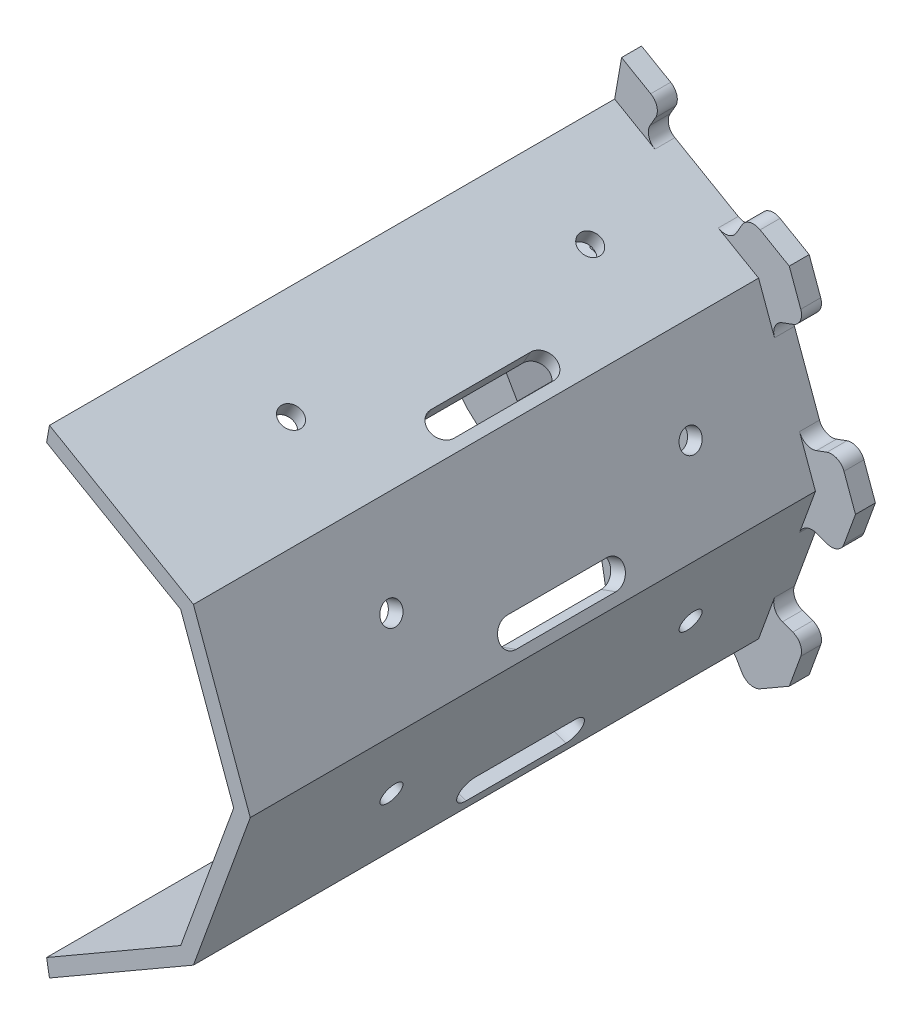
from build123d import *

# Parameters (mm, degrees)
BOSS_EXTRUDE1_DEPTH = 85
CUT_EXTRUDE1_DEPTH  = 100.2782481367037
CUT_EXTRUDE2_REACH  = 121.163
SKETCH3_R           = 1.6500000000000004
SKETCH3_R_2         = 1.65
CUT_EXTRUDE6_REACH  = 120.075
SKETCH4_R           = 1.6500000000000006
SKETCH4_R_2         = 1.6500000000000021
CUT_EXTRUDE7_REACH  = 120.075
SKETCH5_R           = 1.6499999999999986
SKETCH5_R_2         = 1.6499999999999955
CUT_EXTRUDE8_REACH  = 121.163
SKETCH6_R           = 1.65
SKETCH6_R_2         = 1.6499999999999995
BOSS_EXTRUDE2_DEPTH = 3
SKETCH8_R           = 15
BOSS_EXTRUDE3_DEPTH = 5
CUT_EXTRUDE9_DEPTH  = 6
CUT_EXTRUDE10_REACH = 106.715
SKETCH10_R          = 3.5
CUT_EXTRUDE12_REACH = 105.896
FILLET1_R           = 2
CUT_EXTRUDE13_REACH = 105.896
CUT_EXTRUDE14_REACH = 105.896
CUT_EXTRUDE15_REACH = 105.896
FILLET2_R           = 2
CUT_EXTRUDE16_REACH = 127.017
CUT_EXTRUDE17_REACH = 125.808
CUT_EXTRUDE18_REACH = 125.808
CUT_EXTRUDE19_REACH = 127.017
CUT_EXTRUDE20_DEPTH = 1
SPLIT3_START        = -3
SPLIT3_DEPTH        = 88


# Read off the part's stored shape, not the designer's step: Split3
with BuildPart() as part:
    # Sketch1 → Boss-Extrude1 (new body)
    with BuildSketch(Plane.XY):
        Polygon((36.54755500203861, 0), (27.99705141889689, 23.49231551964772), (6.346416324285921, 35.992315519647725), (-18.2737775010193, 31.651111077974463), (-34.34346774318279, 12.499999999999993), (-34.34346774318279, -12.5), (-18.2737775010193, -31.651111077974456), (6.346416324285918, -35.99231551964772), (27.997051418896884, -23.492315519647722), align=None)
    extrude(amount=BOSS_EXTRUDE1_DEPTH)

    # Sketch2 → Cut-Extrude1 (cut, through all)
    with BuildSketch(Plane.XY.offset(85)):
        Polygon((34.053688719229186, -1.736e-14), (26.08663901106896, 21.88928917284279), (5.913360988931043, 33.53633666936129), (-17.0268443596146, 29.49135952342006), (-32.000000000000014, 11.647047496518487), (-32.00000000000002, -11.647047496518473), (-17.02684435961461, -29.491359523420048), (5.913360988931034, -33.53633666936129), (26.08663901106894, -21.889289172842815), align=None)
    extrude(amount=-CUT_EXTRUDE1_DEPTH, mode=Mode.SUBTRACT)

    # Sketch3 → Cut-Extrude2 (cut, up to next)
    with BuildSketch(Plane(origin=(17.1717338715914, 29.742315519647722, 0), x_dir=(0.8660254037844386, -0.5000000000000001, 0), z_dir=(0.5000000000000001, 0.8660254037844386, 0)), mode=Mode.PRIVATE) as cut_extrude2_sk1:
        with Locations(Location((0, -14.5, 0), (0, 0, 180))):
            Circle(SKETCH3_R)
    cut_extrude2_tool1 = extrude(cut_extrude2_sk1.sketch, amount=-CUT_EXTRUDE2_REACH, mode=Mode.PRIVATE) & part.part
    # Sketch3 → Cut-Extrude2 (cut, up to next)
    with BuildSketch(Plane(origin=(17.1717338715914, 29.742315519647722, 0), x_dir=(0.8660254037844386, -0.5000000000000001, 0), z_dir=(0.5000000000000001, 0.8660254037844386, 0)), mode=Mode.PRIVATE) as cut_extrude2_sk2:
        with Locations(Location((0, -59.5, 0), (0, 0, 180))):
            Circle(SKETCH3_R_2)
    cut_extrude2_tool2 = extrude(cut_extrude2_sk2.sketch, amount=-CUT_EXTRUDE2_REACH, mode=Mode.PRIVATE) & part.part
    add(cut_extrude2_tool1.solids().sort_by_distance((17.171734, 29.742316, 14.5))[0], mode=Mode.SUBTRACT)
    add(cut_extrude2_tool2.solids().sort_by_distance((17.171734, 29.742316, 59.5))[0], mode=Mode.SUBTRACT)

    # Sketch4 → Cut-Extrude6 (cut, up to next)
    with BuildSketch(Plane(origin=(32.27230321046776, 11.746157759823863, 0), x_dir=(0, 0, -1), z_dir=(0.9396926207859085, 0.34202014332566866, 0)), mode=Mode.PRIVATE) as cut_extrude6_sk1:
        with Locations(Location((-14.5, 0, 0), (0, 0, 90))):
            Circle(SKETCH4_R)
    cut_extrude6_tool1 = extrude(cut_extrude6_sk1.sketch, amount=-CUT_EXTRUDE6_REACH, mode=Mode.PRIVATE) & part.part
    # Sketch4 → Cut-Extrude6 (cut, up to next)
    with BuildSketch(Plane(origin=(32.27230321046776, 11.746157759823863, 0), x_dir=(0, 0, -1), z_dir=(0.9396926207859085, 0.34202014332566866, 0)), mode=Mode.PRIVATE) as cut_extrude6_sk2:
        with Locations(Location((-59.5, 0, 0), (0, 0, 90))):
            Circle(SKETCH4_R_2)
    cut_extrude6_tool2 = extrude(cut_extrude6_sk2.sketch, amount=-CUT_EXTRUDE6_REACH, mode=Mode.PRIVATE) & part.part
    add(cut_extrude6_tool1.solids().sort_by_distance((32.272303, 11.746158, 14.5))[0], mode=Mode.SUBTRACT)
    add(cut_extrude6_tool2.solids().sort_by_distance((32.272303, 11.746158, 59.5))[0], mode=Mode.SUBTRACT)

    # Sketch5 → Cut-Extrude7 (cut, up to next)
    with BuildSketch(Plane(origin=(32.27230321046775, -11.746157759823864, 0), x_dir=(0, 0, -1), z_dir=(0.9396926207859084, -0.34202014332566877, 0)), mode=Mode.PRIVATE) as cut_extrude7_sk1:
        with Locations(Location((-14.5, 1.73e-15, 0), (0, 0, 90))):
            Circle(SKETCH5_R)
    cut_extrude7_tool1 = extrude(cut_extrude7_sk1.sketch, amount=-CUT_EXTRUDE7_REACH, mode=Mode.PRIVATE) & part.part
    # Sketch5 → Cut-Extrude7 (cut, up to next)
    with BuildSketch(Plane(origin=(32.27230321046775, -11.746157759823864, 0), x_dir=(0, 0, -1), z_dir=(0.9396926207859084, -0.34202014332566877, 0)), mode=Mode.PRIVATE) as cut_extrude7_sk2:
        with Locations(Location((-59.5, 1.73e-15, 0), (0, 0, 90))):
            Circle(SKETCH5_R_2)
    cut_extrude7_tool2 = extrude(cut_extrude7_sk2.sketch, amount=-CUT_EXTRUDE7_REACH, mode=Mode.PRIVATE) & part.part
    add(cut_extrude7_tool1.solids().sort_by_distance((32.272303, -11.746158, 14.5))[0], mode=Mode.SUBTRACT)
    add(cut_extrude7_tool2.solids().sort_by_distance((32.272303, -11.746158, 59.5))[0], mode=Mode.SUBTRACT)

    # Sketch6 → Cut-Extrude8 (cut, up to next)
    with BuildSketch(Plane(origin=(17.171733871591393, -29.74231551964772, 0), x_dir=(0.8660254037844387, 0.4999999999999999, 0), z_dir=(0.4999999999999999, -0.8660254037844387, 0)), mode=Mode.PRIVATE) as cut_extrude8_sk1:
        with Locations((-1.73e-15, 14.5)):
            Circle(SKETCH6_R)
    cut_extrude8_tool1 = extrude(cut_extrude8_sk1.sketch, amount=-CUT_EXTRUDE8_REACH, mode=Mode.PRIVATE) & part.part
    # Sketch6 → Cut-Extrude8 (cut, up to next)
    with BuildSketch(Plane(origin=(17.171733871591393, -29.74231551964772, 0), x_dir=(0.8660254037844387, 0.4999999999999999, 0), z_dir=(0.4999999999999999, -0.8660254037844387, 0)), mode=Mode.PRIVATE) as cut_extrude8_sk2:
        with Locations((-1.73e-15, 59.5)):
            Circle(SKETCH6_R_2)
    cut_extrude8_tool2 = extrude(cut_extrude8_sk2.sketch, amount=-CUT_EXTRUDE8_REACH, mode=Mode.PRIVATE) & part.part
    add(cut_extrude8_tool1.solids().sort_by_distance((17.171734, -29.742316, 14.5))[0], mode=Mode.SUBTRACT)
    add(cut_extrude8_tool2.solids().sort_by_distance((17.171734, -29.742316, 59.5))[0], mode=Mode.SUBTRACT)

    # Sketch7 → Boss-Extrude2 (add)
    with BuildSketch(Plane(origin=(0, 0, 0), x_dir=(-1, 0, 0), z_dir=(0, 0, -1))):
        Polygon((39.999999999999886, 14.558809370648529), (21.28355544951785, 36.86419940427531), (-7.391701236164245, 41.92042083670155), (-32.60829876383648, 27.36161146605319), (-42.567110899036514, -4.2288e-13), (-32.60829876383592, -27.36161146605385), (-7.391701236163371, -41.920420836701695), (21.283555449518634, -36.86419940427485), (40.000000000000185, -14.558809370647692), align=None)
    extrude(amount=BOSS_EXTRUDE2_DEPTH)

    # Sketch8 → Boss-Extrude3 (add)
    with BuildSketch(Plane.XY):
        with Locations(Location((0, 0, 0), (0, 0, 180))):
            Circle(SKETCH8_R)
    extrude(amount=BOSS_EXTRUDE3_DEPTH)

    # Sketch9 → Cut-Extrude9 (cut)
    with BuildSketch(Plane.XY.offset(5)):
        Polygon((6.579999999999997, 1.3e-15), (3.2899999999999987, 5.698447156901607), (-3.2899999999999987, 5.698447156901609), (-6.58, 8.7e-16), (-3.2900000000000005, -5.698447156901607), (3.289999999999996, -5.69844715690161), align=None)
    extrude(amount=-CUT_EXTRUDE9_DEPTH, mode=Mode.SUBTRACT)

    # Sketch10 → Cut-Extrude10 (cut, up to next)
    with BuildSketch(Plane.XY.offset(-1), mode=Mode.PRIVATE) as cut_extrude10_sk1:
        Circle(SKETCH10_R)
    cut_extrude10_tool1 = extrude(cut_extrude10_sk1.sketch, amount=-CUT_EXTRUDE10_REACH, mode=Mode.PRIVATE) & part.part
    add(cut_extrude10_tool1.solids().sort_by_distance((0, 0, -1))[0], mode=Mode.SUBTRACT)

    # Sketch12 → Cut-Extrude12 (cut, up to next)
    with BuildSketch(Plane.XY, mode=Mode.PRIVATE) as cut_extrude12_sk1:
        Polygon((26.495190528383667, 30.891016151377276), (23.666924399975038, 25.992315519647523), (10.676543343208465, 33.49231551964752), (13.50480947161717, 38.39101615137741), align=None)
    cut_extrude12_tool1 = extrude(cut_extrude12_sk1.sketch, amount=-CUT_EXTRUDE12_REACH, mode=Mode.PRIVATE) & part.part
    add(cut_extrude12_tool1.solids().sort_by_distance((18.585867, 32.191666, 0))[0], mode=Mode.SUBTRACT)

    # Fillet1
    fillet1_edges = [part.edges().sort_by_distance(p)[0] for p in [
        (13.50480947161717, 38.39101615137741, -1.5),
        (26.495190528383667, 30.891016151377276, -1.5),
        (23.666924399975038, 25.992315519647523, -1.5),
        (10.676543343208465, 33.49231551964752, -1.5),
    ]]
    fillet(fillet1_edges, radius=FILLET1_R)

    # Sketch13 → Cut-Extrude13 (cut, up to next)
    with BuildSketch(Plane.XY, mode=Mode.PRIVATE) as cut_extrude13_sk1:
        Polygon((40.15285590637897, 6.633111077131995), (34.8374542854104, 4.698463103929174), (29.707152135525373, 18.793852415717794), (35.02255375649406, 20.728500388920715), align=None)
    cut_extrude13_tool1 = extrude(cut_extrude13_sk1.sketch, amount=-CUT_EXTRUDE13_REACH, mode=Mode.PRIVATE) & part.part
    add(cut_extrude13_tool1.solids().sort_by_distance((34.930004, 12.713482, 0))[0], mode=Mode.SUBTRACT)

    # Sketch14 → Cut-Extrude14 (cut, up to next)
    with BuildSketch(Plane.XY, mode=Mode.PRIVATE) as cut_extrude14_sk1:
        Polygon((37.58770483143622, -13.680805733027139), (35.02255375649384, -20.728500388921514), (29.70715213552509, -18.79385241571856), (34.83745428541012, -4.698463103929938), (40.152855906378804, -6.633111077132863), align=None)
    cut_extrude14_tool1 = extrude(cut_extrude14_sk1.sketch, amount=-CUT_EXTRUDE14_REACH, mode=Mode.PRIVATE) & part.part
    add(cut_extrude14_tool1.solids().sort_by_distance((34.930004, -12.713482, 0))[0], mode=Mode.SUBTRACT)

    # Sketch15 → Cut-Extrude15 (cut, up to next)
    with BuildSketch(Plane.XY, mode=Mode.PRIVATE) as cut_extrude15_sk1:
        Polygon((19.99999999999965, -34.64101615137777), (13.504809471616262, -38.391016151377734), (10.67654334320774, -33.49231551964793), (23.666924399974317, -25.992315519647935), (26.49519052838297, -30.891016151377844), align=None)
    cut_extrude15_tool1 = extrude(cut_extrude15_sk1.sketch, amount=-CUT_EXTRUDE15_REACH, mode=Mode.PRIVATE) & part.part
    add(cut_extrude15_tool1.solids().sort_by_distance((18.585867, -32.191666, 0))[0], mode=Mode.SUBTRACT)

    # Fillet2
    fillet2_edges = [part.edges().sort_by_distance(p)[0] for p in [
        (35.02255375649406, 20.728500388920715, -1.5),
        (40.15285590637897, 6.633111077131995, -1.5),
        (34.8374542854104, 4.698463103929174, -1.5),
        (29.707152135525373, 18.793852415717794, -1.5),
        (40.152855906378804, -6.633111077132863, -1.5),
        (35.02255375649384, -20.728500388921514, -1.5),
        (29.70715213552509, -18.79385241571856, -1.5),
        (34.83745428541012, -4.698463103929938, -1.5),
        (26.49519052838297, -30.891016151377844, -1.5),
        (13.504809471616262, -38.391016151377734, -1.5),
        (10.67654334320774, -33.49231551964793, -1.5),
        (23.666924399974317, -25.992315519647935, -1.5),
    ]]
    fillet(fillet2_edges, radius=FILLET2_R)

    # Sketch16 → Cut-Extrude16 (cut, up to next)
    with BuildSketch(Plane(origin=(17.1717338715914, 29.742315519647722, 0), x_dir=(0.8660254037844386, -0.5000000000000001, 0), z_dir=(0.5000000000000001, 0.8660254037844386, 0)), mode=Mode.PRIVATE) as cut_extrude16_sk1:
        with BuildLine():
            Line((6.999999999999999, -44.5), (6.9999999999999964, -29.5))
            ThreePointArc((6.9999999999999964, -29.5), (8.999999999999996, -27.5), (10.999999999999996, -29.5))
            Line((10.999999999999996, -29.5), (11, -44.5))
            ThreePointArc((11, -44.5), (9, -46.5), (6.999999999999999, -44.5))
        make_face()
    cut_extrude16_tool1 = extrude(cut_extrude16_sk1.sketch, amount=-CUT_EXTRUDE16_REACH, mode=Mode.PRIVATE) & part.part
    add(cut_extrude16_tool1.solids().sort_by_distance((24.965963, 25.242316, 37))[0], mode=Mode.SUBTRACT)

    # Sketch17 → Cut-Extrude17 (cut, up to next)
    with BuildSketch(Plane(origin=(32.27230321046776, 11.746157759823863, 0), x_dir=(0, 0, -1), z_dir=(0.9396926207859085, 0.34202014332566866, 0)), mode=Mode.PRIVATE) as cut_extrude17_sk1:
        with BuildLine():
            Line((-44.5, -6.999999999999997), (-29.5, -6.999999999999995))
            ThreePointArc((-29.5, -6.999999999999995), (-27.5, -8.999999999999995), (-29.5, -10.999999999999995))
            Line((-29.5, -10.999999999999995), (-44.5, -10.999999999999998))
            ThreePointArc((-44.5, -10.999999999999998), (-46.5, -8.999999999999998), (-44.5, -6.999999999999997))
        make_face()
    cut_extrude17_tool1 = extrude(cut_extrude17_sk1.sketch, amount=-CUT_EXTRUDE17_REACH, mode=Mode.PRIVATE) & part.part
    add(cut_extrude17_tool1.solids().sort_by_distance((35.350485, 3.288924, 37))[0], mode=Mode.SUBTRACT)

    # Sketch18 → Cut-Extrude18 (cut, up to next)
    with BuildSketch(Plane(origin=(32.27230321046775, -11.746157759823864, 0), x_dir=(0, 0, -1), z_dir=(0.9396926207859084, -0.34202014332566877, 0)), mode=Mode.PRIVATE) as cut_extrude18_sk1:
        with BuildLine():
            Line((-44.5, -6.999999999999999), (-29.5, -6.9999999999999964))
            ThreePointArc((-29.5, -6.9999999999999964), (-27.5, -8.999999999999996), (-29.5, -10.999999999999996))
            Line((-29.5, -10.999999999999996), (-44.5, -11))
            ThreePointArc((-44.5, -11), (-46.5, -9), (-44.5, -6.999999999999999))
        make_face()
    cut_extrude18_tool1 = extrude(cut_extrude18_sk1.sketch, amount=-CUT_EXTRUDE18_REACH, mode=Mode.PRIVATE) & part.part
    add(cut_extrude18_tool1.solids().sort_by_distance((29.194122, -20.203391, 37))[0], mode=Mode.SUBTRACT)

    # Sketch19 → Cut-Extrude19 (cut, up to next)
    with BuildSketch(Plane(origin=(17.171733871591393, -29.74231551964772, 0), x_dir=(0.8660254037844387, 0.4999999999999999, 0), z_dir=(0.4999999999999999, -0.8660254037844387, 0)), mode=Mode.PRIVATE) as cut_extrude19_sk1:
        with BuildLine():
            Line((-7.0000000000000036, 44.5), (-6.999999999999999, 29.5))
            ThreePointArc((-6.999999999999999, 29.5), (-9, 27.5), (-11, 29.5))
            Line((-11, 29.5), (-11.000000000000005, 44.5))
            ThreePointArc((-11.000000000000005, 44.5), (-9.000000000000005, 46.5), (-7.0000000000000036, 44.5))
        make_face()
    cut_extrude19_tool1 = extrude(cut_extrude19_sk1.sketch, amount=-CUT_EXTRUDE19_REACH, mode=Mode.PRIVATE) & part.part
    add(cut_extrude19_tool1.solids().sort_by_distance((9.377505, -34.242316, 37))[0], mode=Mode.SUBTRACT)

    # Sketch20 → Cut-Extrude20 (cut)
    # profile 1 of 2: a face of its own
    with BuildSketch(Plane.XY.offset(5)):
        Polygon((10.699015168569945, 2.399840191965864), (10.762817251903279, 2.399840191965864), (10.762817251903279, -0.02323673111105976), (11.166663405749432, -0.02323673111105976), (11.166663405749432, -0.38221109008541876), (10.762817251903279, -0.38221109008541876), (10.762817251903279, -1.1899033977777265), (10.448714687800715, -1.1899033977777265), (10.448714687800715, -0.38221109008541876), (8.788458277544304, -0.38221109008541876), align=None)
        Polygon((10.448714687800715, -0.02323673111105976), (10.448714687800715, 1.4967953201709916), (9.405445457031483, -0.02323673111105976), align=None, mode=Mode.SUBTRACT)
    # profile 2 of 2: a face of its own
    with BuildSketch(Plane.XY.offset(5)):
        with BuildLine():
            add(Edge.make_bspline(
                [(11.480765969851998, 0.5586943586325299), (11.481093988009462, 0.6147917463667792), (11.481731168008308, 0.7237617306142458), (11.48881958895055, 0.8825463726810457), (11.500594931263722, 1.031506661676222), (11.516732304113997, 1.170649727714649), (11.536370284337591, 1.3000114922323585), (11.562585770938904, 1.4192462493686593), (11.59239857355387, 1.5289058559817197), (11.626951019364371, 1.6293479044577401), (11.665938808382716, 1.7219256074799023), (11.708373069104784, 1.8083508087736644), (11.755937863528358, 1.8884927411134407), (11.805914776455467, 1.9636305315333873), (11.860326848083279, 2.0325342263257244), (11.917625638550524, 2.09617688884425), (11.980047514817652, 2.15308763930806), (12.0454705230911, 2.204933941693136), (12.114486987482817, 2.250383413365079), (12.185129653626019, 2.2904161519808395), (12.257884759481957, 2.324616019238447), (12.33295094237989, 2.351506455097987), (12.409653500269574, 2.3737173018705997), (12.488260566960866, 2.3889062495171682), (12.568901930897189, 2.3984631580065576), (12.623333365695336, 2.3993768257467534), (12.650938245493021, 2.399840191965864)],
                knots=[0, 0, 0, 0, 1.646270934209821, 3.1979050186392235, 4.663502075238151, 6.030701354807192, 7.308322542152325, 8.501637759679799, 9.611534130575741, 10.641858118523807, 11.616356846792282, 12.55805521855688, 13.465016945480649, 14.349605744745595, 15.2044437325487, 16.039544428071643, 16.85989611087316, 17.68044848432301, 18.487036064658945, 19.282494120461983, 20.06191083998469, 20.843045898942993, 21.620316917836394, 22.403196591136986, 23.190181807154957, 24, 24, 24, 24], degree=3))
            add(Edge.make_bspline(
                [(12.650938245493021, 2.399840191965864), (12.678773723977363, 2.399352376790199), (12.734129732873047, 2.398382265885918), (12.815970108118965, 2.389058323351313), (12.895919789833563, 2.373587200254381), (12.973637928537045, 2.351666225671719), (13.049762915004822, 2.3244705490122977), (13.123699322650472, 2.290383431903125), (13.195906404292517, 2.2507045645586583), (13.265236691812417, 2.2040806872520324), (13.332451307158497, 2.1520984110552694), (13.395899270130595, 2.0933357422519316), (13.455586356028055, 2.0283860229832724), (13.512261661414287, 1.9579441590966649), (13.564317258613535, 1.8806590742630822), (13.613890690848967, 1.7978749644489376), (13.658262726750625, 1.7081440996551294), (13.700997401929225, 1.6129636318140836), (13.737884388668466, 1.5096999730074172), (13.77115063394078, 1.3989352124893275), (13.798029602515713, 1.2793610256359849), (13.820418874853852, 1.1516047803408764), (13.837763770799462, 1.0151972971007155), (13.850396412878016, 0.8704309815889567), (13.857069497919351, 0.7172105909481908), (13.858326199126024, 0.6124527417710297), (13.858971098057125, 0.5586943586325299)],
                knots=[0, 0, 0, 0, 0.8109147879050582, 1.6126543769731265, 2.3966978605638127, 3.1815986910302008, 3.963628158114887, 4.749916496539013, 5.551656085607076, 6.361998678416954, 7.182127410194754, 8.025565596119497, 8.878627764223396, 9.750805456801475, 10.657531672764197, 11.591944964946613, 12.560506718719303, 13.572878150499578, 14.630710177579665, 15.75337947303401, 16.941251878474972, 18.199788006281548, 19.531962790587603, 20.947069416945357, 22.433333508961777, 24, 24, 24, 24], degree=3))
            add(Edge.make_bspline(
                [(13.858971098057125, 0.5586943586325299), (13.858319513513203, 0.5051704506916248), (13.857049927601706, 0.40088129883279877), (13.85047122083399, 0.24835032351300967), (13.837512589655258, 0.10435228021444816), (13.821302601346485, -0.03145818224426963), (13.798851638373057, -0.1585158010772283), (13.771246472121776, -0.2772602495451371), (13.740596149300012, -0.3882043212105647), (13.702761355190209, -0.49043913282051943), (13.661350644842978, -0.5853908556853121), (13.616295448667598, -0.6740580040150086), (13.568025622581917, -0.7572242966946482), (13.51543687757889, -0.8342240436258059), (13.459383464382462, -0.9056027006986748), (13.398665675589474, -0.9701003233502088), (13.334995090487487, -1.0292709953133528), (13.26758267465354, -1.08192262277551), (13.19717112342139, -1.1280074274118699), (13.125212046496495, -1.169221277799689), (13.050428663149214, -1.2024539728495385), (12.974515710419706, -1.2309890138272908), (12.896387344304754, -1.2527894657134357), (12.816140953615308, -1.2678633212340344), (12.73418471768662, -1.2784351696888103), (12.678783152605364, -1.2792416495641143), (12.650938245493021, -1.2796469875213161)],
                knots=[0, 0, 0, 0, 1.5615189508146985, 3.0425559951965497, 4.452378317425898, 5.77835230002516, 7.031515104566354, 8.21400894671442, 9.334062868455847, 10.38661593739945, 11.391082383146825, 12.354592575310878, 13.286541443962617, 14.19423375434815, 15.072674878705618, 15.93128721864769, 16.77562406715994, 17.606195743360928, 18.42308325962735, 19.229000346878212, 20.022332153438946, 20.80753667349063, 21.593273796435845, 22.384845899964912, 23.18822120238598, 24, 24, 24, 24], degree=3))
            add(Edge.make_bspline(
                [(12.650938245493021, -1.2796469875213161), (12.623334131507768, -1.2791806320625072), (12.568904206742257, -1.27826107012509), (12.488251781302804, -1.2687473386369021), (12.409969337862863, -1.2534518354245472), (12.333670583825253, -1.2320352313334628), (12.25896406874157, -1.2058203950180253), (12.186867782085773, -1.171666711415043), (12.116580098395099, -1.1323326424590767), (12.04828854237702, -1.0875372210207943), (11.983276381337184, -1.036215537892402), (11.921177776023347, -0.9794512492059136), (11.863552756926376, -0.9158278379084959), (11.809918661309052, -0.846349914800778), (11.75894457311331, -0.7716566724680276), (11.71205519979406, -0.6907282994226058), (11.668684345726003, -0.6038856889329994), (11.62904085505748, -0.5105677782579008), (11.59389219154256, -0.4094128503981133), (11.562844483429135, -0.29926367189562586), (11.538330325959071, -0.17914803578158284), (11.517347370626194, -0.05003066867619932), (11.500422987582695, 0.08864326170964566), (11.488868662264327, 0.23694903989653873), (11.481727347228567, 0.3947942488226865), (11.48109227680845, 0.5030640231392943), (11.480765969851998, 0.5586943586325299)],
                knots=[0, 0, 0, 0, 0.8108915123277817, 1.5989197853830515, 2.382837074303322, 3.1526679610236004, 3.9260445022882253, 4.706494247689628, 5.4936541037716, 6.291793341720177, 7.103789334199586, 7.925228297395194, 8.761435821406893, 9.62281769616258, 10.502889169841703, 11.416980706490204, 12.369136599001163, 13.353924995835937, 14.39435591694554, 15.514179734018091, 16.7143546684216, 17.99475642723738, 19.357759367412772, 20.818452757569585, 22.36528207802098, 24, 24, 24, 24], degree=3))
        make_face()
        with BuildLine():
            add(Edge.make_bspline(
                [(11.794868533954562, 0.5600966022222735), (11.794987981022075, 0.51334790341842), (11.795219804325486, 0.42261785861926177), (11.801276004902704, 0.2907745976433207), (11.809526236902183, 0.16780426882616337), (11.820167534087329, 0.05355073236103097), (11.835970482613353, -0.05159928014877718), (11.853677270431032, -0.14836896321391158), (11.87522536005025, -0.23624620032771593), (11.900720377917256, -0.31583401103224584), (11.929759474810716, -0.38848307952759553), (11.96146533848078, -0.45608429465493394), (11.995526061385695, -0.519436231090715), (12.033645211938678, -0.5779698394648384), (12.075160275167676, -0.631876003537701), (12.119133534305172, -0.6821088358599933), (12.167206118547286, -0.726905817195589), (12.2337098610905, -0.78063267222506), (12.321506335517544, -0.8361518059546592), (12.432126790748649, -0.8844978957862915), (12.545795241730156, -0.9148803522186036), (12.622946491817084, -0.9187441081737272), (12.6614550724161, -0.9206726285469573)],
                knots=[0, 0, 0, 0, 1.459021317517331, 2.8316738837309017, 4.118529203417341, 5.306027143692109, 6.411944654278567, 7.436330061976205, 8.375795394189042, 9.233974572315296, 10.042671642071316, 10.816086305852963, 11.563610506559328, 12.285937304150298, 12.993564865295752, 13.68598920179275, 14.367179055447226, 15.041617292951946, 16.353048772047714, 17.59444152810875, 18.799311194619747, 20, 20, 20, 20], degree=3))
            add(Edge.make_bspline(
                [(12.6614550724161, -0.9206726285469573), (12.700212744071845, -0.9190748477354075), (12.777648067256552, -0.9158825849333581), (12.890781862400893, -0.8850838475591348), (13.000612132483155, -0.8386143080954556), (13.08668407276204, -0.7836668026761942), (13.152166616263477, -0.731338473224922), (13.199083606369387, -0.6867238249120099), (13.24214565480264, -0.6367679576055904), (13.282987729657252, -0.5828686616906794), (13.320446805332137, -0.5239961775168946), (13.354509943027344, -0.4604336022508821), (13.385593290572507, -0.392004424338691), (13.403302336522765, -0.344234685222861), (13.412356514723792, -0.319811250341829)],
                knots=[0, 0, 0, 0, 1.3537608089334987, 2.704726607048761, 4.075137774752408, 5.51610492269836, 6.260822281055196, 7.0071100648669935, 7.778089737184427, 8.566572457356804, 9.372053458888672, 10.217411130678663, 11.088608311970143, 12, 12, 12, 12], degree=3))
            add(Edge.make_bspline(
                [(13.412356514723792, -0.319811250341829), (13.422908282517557, -0.28858151087549916), (13.44433289635002, -0.22517174663203657), (13.471944670620756, -0.12680809455154596), (13.493690069824453, -0.02360533061361056), (13.513253435573883, 0.08381978610483105), (13.526606491471235, 0.19625948711581434), (13.537354304754478, 0.31336587103156177), (13.543684991693734, 0.43522723326700874), (13.54446974276507, 0.5180222244622587), (13.544868533954563, 0.5600966022222735)],
                knots=[0, 0, 0, 0, 0.8847067087626915, 1.7963340324287653, 2.7400279524008315, 3.7145927873388667, 4.726048261614132, 5.777819802844116, 6.870742689669794, 8, 8, 8, 8], degree=3))
            add(Edge.make_bspline(
                [(13.544868533954563, 0.5600966022222735), (13.544318344721626, 0.6021641747403159), (13.543242056966083, 0.684457339520893), (13.539128069264953, 0.8049755201830204), (13.528504494772955, 0.9194432810921721), (13.516705375908451, 1.028353753756486), (13.499308154816362, 1.1311040564609773), (13.480550347936063, 1.228554361717293), (13.455349135645838, 1.3194973865366426), (13.428429360671853, 1.4053569682482479), (13.397618965140419, 1.4851576227490437), (13.363703230882852, 1.5592714091109998), (13.327481472113831, 1.6280561338678075), (13.288139231654565, 1.6913230754443167), (13.246143548589295, 1.7493556183554555), (13.20038599939173, 1.8009902129125308), (13.152681626580879, 1.8478271810210738), (13.085864440757227, 1.901289750142678), (12.998390150956832, 1.955801445625835), (12.889544503614397, 2.005967205486176), (12.776273859363261, 2.034775498107081), (12.699700405271228, 2.0388371851452147), (12.6614550724161, 2.0408658329915044)],
                knots=[0, 0, 0, 0, 1.3136239598127757, 2.5697292834812977, 3.7635026065601553, 4.902122613399723, 5.988968490589504, 7.016458720187642, 7.998833610675549, 8.933434872647435, 9.825090667469954, 10.667526885408725, 11.477055099364469, 12.250526234389058, 12.991942728906572, 13.710640831076994, 14.402115721364014, 15.076753259473001, 16.37850832093427, 17.60986923300326, 18.80622667692114, 20, 20, 20, 20], degree=3))
            add(Edge.make_bspline(
                [(12.6614550724161, 2.0408658329915044), (12.622744480329294, 2.038834386344251), (12.545252774724185, 2.0347677922402787), (12.430804819997427, 2.00607453864869), (12.32110046835513, 1.9560615727110773), (12.233857493676272, 1.901109200246155), (12.166993707168677, 1.8487708888045031), (12.119911013791924, 1.8033844347460413), (12.075764841574228, 1.7537381803809056), (12.03509714143658, 1.69933626553055), (11.997007858244316, 1.640870898211425), (11.962026845668614, 1.577882133486164), (11.930509515992567, 1.5100507692607648), (11.901424979812399, 1.4374343338417017), (11.875852191786176, 1.3578533894061586), (11.85475822855619, 1.2700843958126955), (11.835271175436295, 1.1736225040235095), (11.821475906535737, 1.0679029960783206), (11.809212150774025, 0.9536208427090912), (11.801330802821766, 0.830343524479754), (11.795199545352533, 0.6982791440773953), (11.794981080989782, 0.6070799855747496), (11.794868533954562, 0.5600966022222735)],
                knots=[0, 0, 0, 0, 1.2077323862212441, 2.4176649717199115, 3.655092372502786, 4.95622059516701, 5.62598200086497, 6.301752483013142, 6.994047911005499, 7.697131622371107, 8.419323944522047, 9.17022376522278, 9.94349444254624, 10.752040957325386, 11.610060368400232, 12.549350800534091, 13.567764191184862, 14.679664411851208, 15.874934091016696, 17.15427344321464, 18.533957287227718, 20, 20, 20, 20], degree=3))
        make_face(mode=Mode.SUBTRACT)
    extrude(amount=-CUT_EXTRUDE20_DEPTH, mode=Mode.SUBTRACT)

    # Split3 outline → Split3 (cut)
    with BuildSketch(Plane.XY.offset(SPLIT3_START)):
        with BuildLine():
            Line((-21.28355545, -36.864199404), (7.391701236, -41.920420837))
            Line((7.391701236, -41.920420837), (2.604722665, -14.772116295))
            ThreePointArc((2.604722665, -14.772116295), (-15, 0), (2.604722665, 14.772116295))
            Line((2.604722665, 14.772116295), (7.391701236, 41.920420837))
            Line((7.391701236, 41.920420837), (-21.28355545, 36.864199404))
            Line((-21.28355545, 36.864199404), (-40, 14.558809371))
            Line((-40, 14.558809371), (-40, -14.558809371))
            Line((-40, -14.558809371), (-21.28355545, -36.864199404))
        make_face()
    extrude(amount=SPLIT3_DEPTH, mode=Mode.SUBTRACT)


solid = part.part
